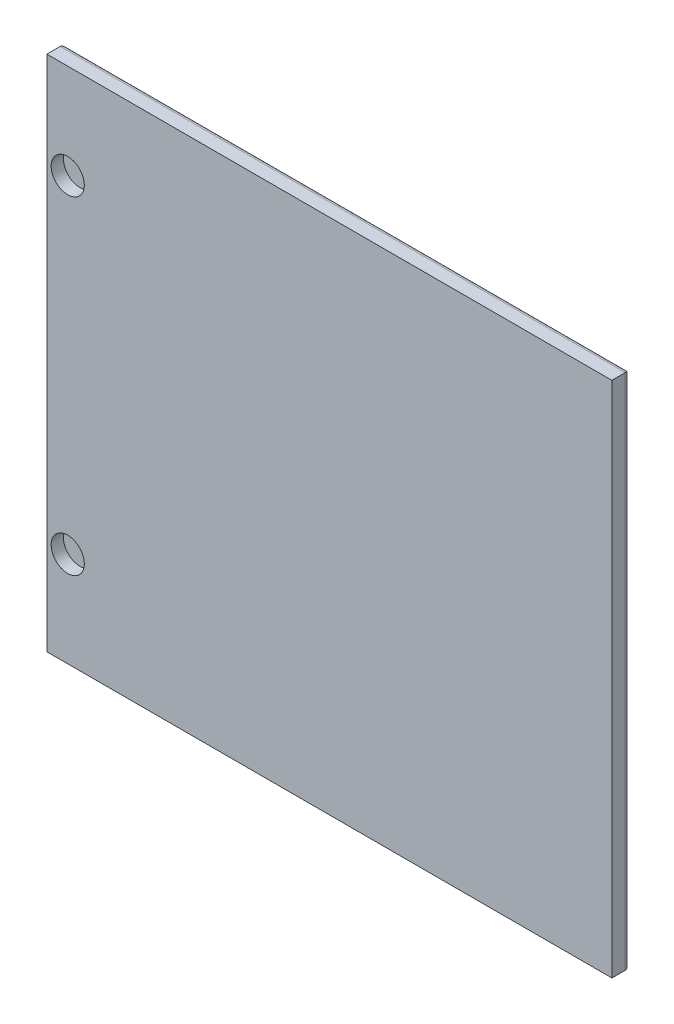
from build123d import *

# Parameters (mm, degrees)
SKETCH_1_W             = 596
SKETCH_1_H             = 546
EXTRUDE_1889_DEPTH     = 19
SKETCH_3_R             = 17.5
CUT_EXTRUDE_1_DEPTH    = 13
SKETCH_4_R             = 17.5
CUT_EXTRUDE_2_DEPTH    = 13
SKETCH_8_W             = 496
SKETCH_8_H             = 446
CUT_EXTRUDE_2298_DEPTH = 6
CUT_EXTRUDE_2298_DRAFT = -45
FILLET_1_R             = 5


with BuildPart() as part:
    # Эскиз1 → Extrude 1889 (new body)
    with BuildSketch(Plane.XY):
        with Locations((298, 273)):
            Rectangle(SKETCH_1_W, SKETCH_1_H)
    extrude(amount=EXTRUDE_1889_DEPTH)

    # Эскиз3 → Отверстие 1 (cut)
    with BuildSketch(Plane.XY.offset(19)):
        with Locations((22, 100)):
            Circle(SKETCH_3_R)
    extrude(amount=-CUT_EXTRUDE_1_DEPTH, mode=Mode.SUBTRACT)

    # Эскиз4 → Отверстие 2 (cut)
    with BuildSketch(Plane.XY.offset(19)):
        with Locations((22, 446)):
            Circle(SKETCH_4_R)
    extrude(amount=-CUT_EXTRUDE_2_DEPTH, mode=Mode.SUBTRACT)


with BuildPart() as cut_extrude_2298_tool:
    # Эскиз8 → Cut-Extrude 2298 (with draft: the straight prism first)
    with BuildSketch(Plane(origin=(0, 0, 0), x_dir=(-1, 0, 0), z_dir=(0, 0, -1))):
        with Locations((-298, 273)):
            Rectangle(SKETCH_8_W, SKETCH_8_H)
    extrude(amount=-CUT_EXTRUDE_2298_DEPTH)
    # Cut-Extrude 2298: the draft: its side faces are tilted about the plane it starts from
    cut_extrude_2298_sides = [cut_extrude_2298_tool.faces().sort_by_distance(p)[0] for p in [
        (298, 50, 3),
        (50, 273, 3),
        (298, 496, 3),
        (546, 273, 3),
    ]]
    draft(cut_extrude_2298_sides, Plane(origin=(0, 0, 0), x_dir=(-1, 0, 0), z_dir=(0, 0, -1)), CUT_EXTRUDE_2298_DRAFT)


with BuildPart() as part_1:
    add(part.part)

    # Cut-Extrude 2298: cut by cut_extrude_2298_tool
    add(cut_extrude_2298_tool.part, mode=Mode.SUBTRACT)

    # Скругление1
    fillet_1_edges = [part_1.edges().sort_by_distance(p)[0] for p in [
        (298, 0, 0),
        (596, 273, 0),
        (298, 546, 0),
        (0, 273, 0),
    ]]
    fillet(fillet_1_edges, radius=FILLET_1_R)


solid = part_1.part
